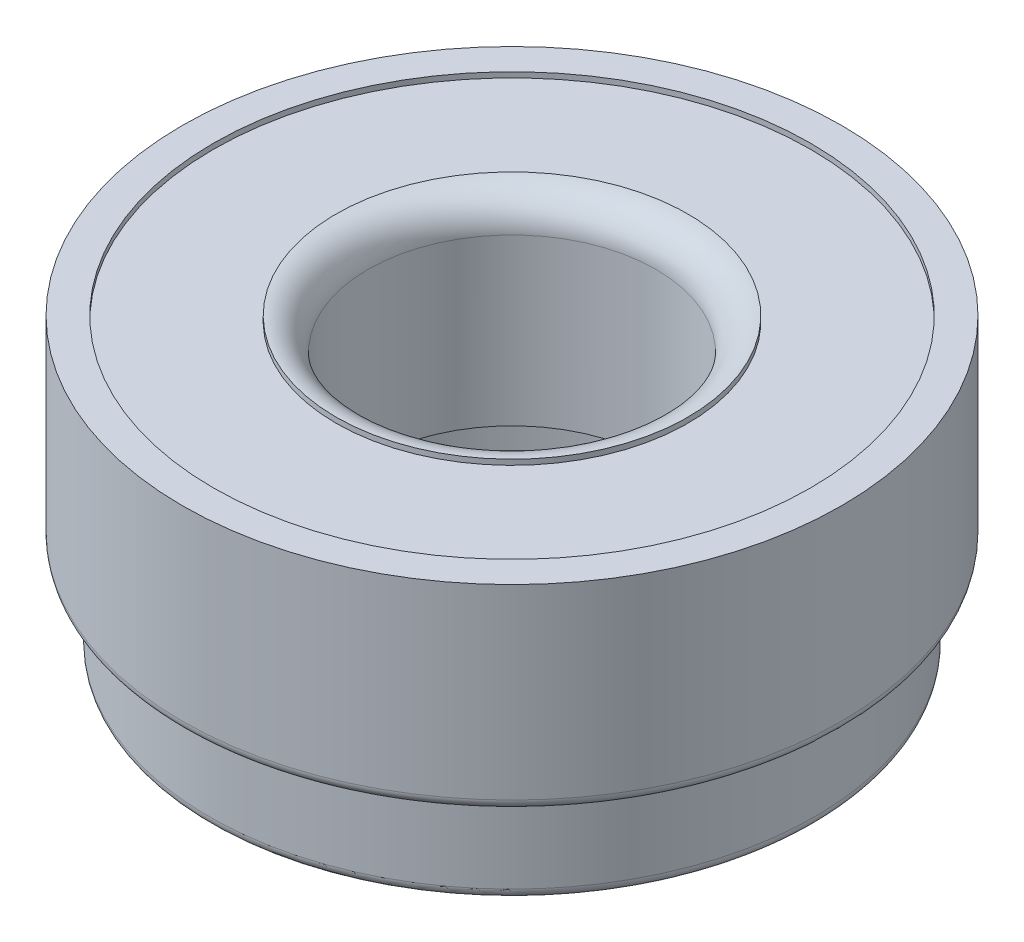
from build123d import *

# Parameters (mm, degrees)
FILLET_1_R          = 1
SKETCH_4_R          = 28
SKETCH_4_R_2        = 16.5
CUT_EXTRUDE_1_DEPTH = 0.5
FILLET_2_R          = 3


with BuildPart() as part:
    # Эскиз3 → Повернуть2 (revolve)
    with BuildSketch(Plane.XY, mode=Mode.PRIVATE) as revolve_2_sk:
        Polygon((23.4, 0), (28.4, 0), (28.4, 9), (30.9, 9), (30.9, 27.5), (13.5, 27.5), (13.5, 9), (23.4, 9), align=None)
    revolve(revolve_2_sk.sketch.rotate(Axis((0, 0, 0), (0, 1, 0)), 90), axis=Axis((0, 0, 0), (0, 1, 0)))

    # Скругление1
    fillet_1_edges = [part.edges().sort_by_distance(p)[0] for p in [
        (0, 9, 30.9),
        (0, 0, 28.4),
    ]]
    fillet(fillet_1_edges, radius=FILLET_1_R)

    # Эскиз4 → Вырез-Вытянуть1 (cut)
    with BuildSketch(Plane(origin=(0, 27.5, 0), x_dir=(1, 0, 0), z_dir=(0, 1, 0))):
        with Locations(Location((0, 0, 0), (0, 0, 270))):
            Circle(SKETCH_4_R)
        with Locations(Location((0, 0, 0), (0, 0, 270))):
            Circle(SKETCH_4_R_2, mode=Mode.SUBTRACT)
    extrude(amount=-CUT_EXTRUDE_1_DEPTH, mode=Mode.SUBTRACT)

    # Скругление2
    fillet_2_edges = [part.edges().sort_by_distance(p)[0] for p in [
        (0, 27.5, 13.5),
    ]]
    fillet(fillet_2_edges, radius=FILLET_2_R - 0.0001)  # a hair under: the kernel refuses the full size


solid = part.part
